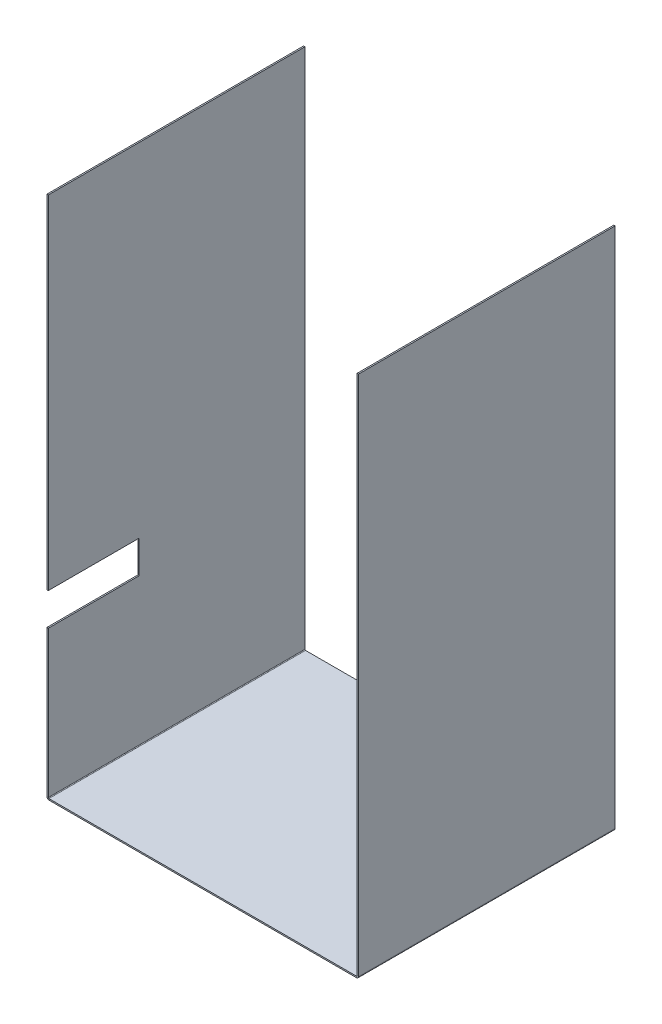
from build123d import *

# Parameters (mm, degrees)
BASE_FLANGE1_DEPTH = 280
SKETCH2_W          = 105.722877612
SKETCH2_H          = 35.527417617
CUT_EXTRUDE1_DEPTH = 10
SKETCH3_R          = 38
CUT_EXTRUDE2_DEPTH = 500


# Sheet-metal steps are written as plain solids
with BuildPart() as part:
    # Sketch1 → Base-Flange1 (new body)
    with BuildSketch(Plane(origin=(0, 0, 0), x_dir=(-1, 0, 0), z_dir=(0, 0, 1))):
        with BuildLine():
            Line((223.448991217, -255.847131966), (223.448991217, 313.416268034))
            ThreePointArc((223.448991217, 313.416268034), (223.233246072, 313.937122889), (222.712391217, 314.152868034))
            Line((222.712391217, 314.152868034), (-112.814408783, 314.152868034))
            ThreePointArc((-112.814408783, 314.152868034), (-113.335263638, 313.937122889), (-113.551008783, 313.416268034))
            Line((-113.551008783, 313.416268034), (-113.551008783, -255.847131966))
            Line((-113.551008783, -255.847131966), (-115.051008783, -255.847131966))
            Line((-115.051008783, -255.847131966), (-115.051008783, 313.416268034))
            ThreePointArc((-115.051008783, 313.416268034), (-114.39592381, 314.997783061), (-112.814408783, 315.652868034))
            Line((-112.814408783, 315.652868034), (222.712391217, 315.652868034))
            ThreePointArc((222.712391217, 315.652868034), (224.293906243, 314.997783061), (224.948991217, 313.416268034))
            Line((224.948991217, 313.416268034), (224.948991217, -255.847131966))
            Line((224.948991217, -255.847131966), (223.448991217, -255.847131966))
        make_face()
    extrude(amount=BASE_FLANGE1_DEPTH)

    # Sketch2 → Cut-Extrude1 (cut)
    with BuildSketch(Plane.ZY.offset(224.948991217)):
        with Locations((233.67908011, -135.779600883)):
            Rectangle(SKETCH2_W, SKETCH2_H)
    extrude(amount=-CUT_EXTRUDE1_DEPTH, mode=Mode.SUBTRACT)

    # Sketch3 → Cut-Extrude2 (cut)
    with BuildSketch(Plane(origin=(0, -314.152868034, 0), x_dir=(1, 0, 0), z_dir=(0, 1, 0))):
        with Locations(Location((33.054236524, -81.51765287, 0), (0, 0, 180))):
            Circle(SKETCH3_R)
    extrude(amount=-CUT_EXTRUDE2_DEPTH, mode=Mode.SUBTRACT)


solid = part.part
